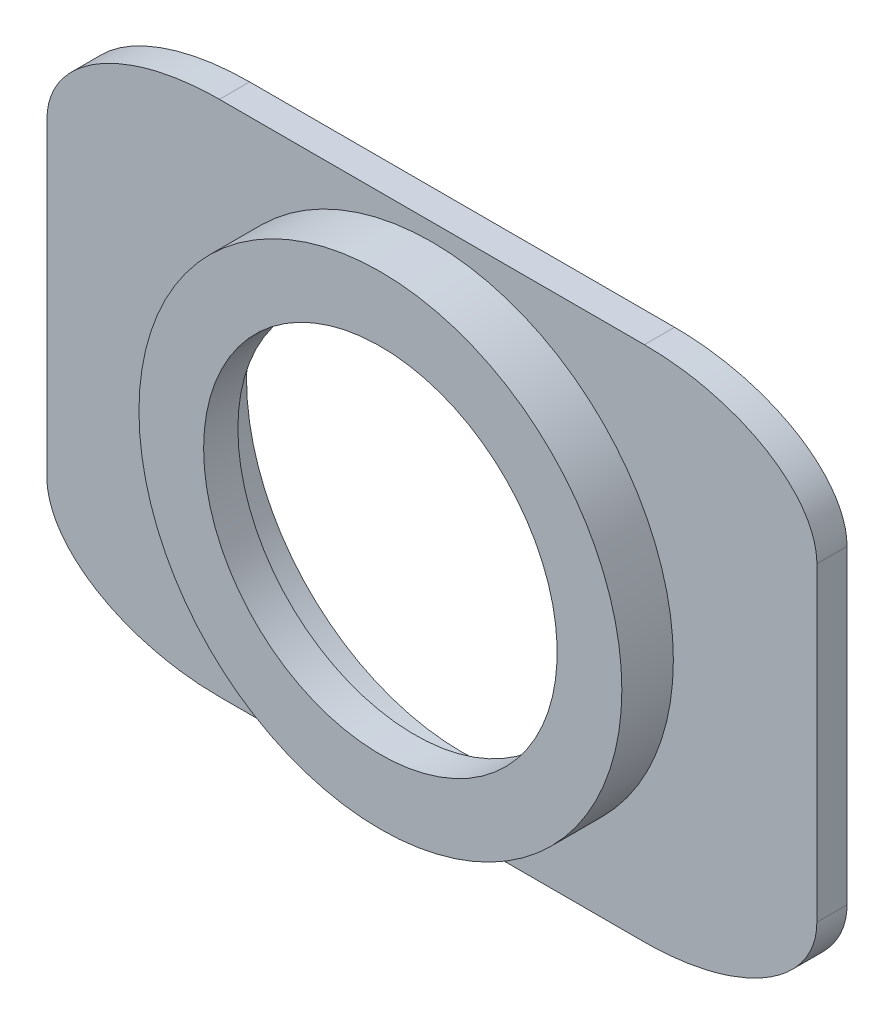
from build123d import *

# Parameters (mm, degrees)
BOSS_EXTRUDE1_DEPTH = 60
SKETCH2_R           = 25
CUT_EXTRUDE1_DEPTH  = 5.5
FILLET1_SIZE        = 12
FILLET1_SIZE_2      = 20
FILLET2_SIZE        = 20
FILLET2_SIZE_2      = 12
FILLET3_SIZE        = 20
FILLET3_SIZE_2      = 12
SKETCH4_R           = 20.5
CUT_EXTRUDE2_DEPTH  = 8.5
SKETCH6_R           = 28
CUT_EXTRUDE3_DEPTH  = 5.973425633


with BuildPart() as part:
    # Sketch1 → Boss-Extrude1 (new body)
    with BuildSketch(Plane(origin=(0, 0, 0), x_dir=(1, 0, 0), z_dir=(0, 1, 0))):
        Polygon((-44.639505024, 1.864709672), (-31.939505024, 1.864709672), (-31.939505024, -4.108715961), (31.939505024, -4.108715961), (31.939505024, 1.864709672), (44.639505024, 1.864709672), (44.639505024, 5.364709672), (-44.639505024, 5.364709672), align=None)
    extrude(amount=BOSS_EXTRUDE1_DEPTH)

    # Sketch2 → Cut-Extrude1 (cut)
    with BuildSketch(Plane(origin=(0, 0, -5.364709672), x_dir=(-1, 0, 0), z_dir=(0, 0, -1))):
        with Locations((0, 30)):
            Circle(SKETCH2_R)
    extrude(amount=-CUT_EXTRUDE1_DEPTH, mode=Mode.SUBTRACT)

    # Fillet1
    # an asymmetric fillet: 20, 12 mm, written as the material it takes off along each edge
    with BuildSketch(Plane(origin=(-44.639505024, 60, -55.364709672), x_dir=(0, -1, 0), z_dir=(0, 0, 1))) as fillet1_piece_1:
        with BuildLine():
            Bezier((FILLET1_SIZE, 0), (0, 0), (0, FILLET1_SIZE_2), weights=[1, 0.707106781, 1])
            Line((0, FILLET1_SIZE_2), (0, 0))
            Line((0, 0), (FILLET1_SIZE, 0))
        make_face()
    extrude(amount=103.5, mode=Mode.SUBTRACT)
    with BuildSketch(Plane(origin=(44.639505024, 60, 48.135290328), x_dir=(-1, 0, 0), z_dir=(0, 0, -1))) as fillet1_piece_2:
        with BuildLine():
            Bezier((FILLET1_SIZE_2, 0), (0, 0), (0, -FILLET1_SIZE), weights=[1, 0.707106781, 1])
            Line((0, -FILLET1_SIZE), (0, 0))
            Line((0, 0), (FILLET1_SIZE_2, 0))
        make_face()
    extrude(amount=103.5, mode=Mode.SUBTRACT)

    # Fillet2
    # an asymmetric fillet: 20, 12 mm, written as the material it takes off along each edge
    with BuildSketch(Plane(origin=(44.639505024, 0, 48.135290328), x_dir=(-1, 0, 0), z_dir=(0, 0, -1))) as fillet2_piece_1:
        with BuildLine():
            Bezier((FILLET2_SIZE, 0), (0, 0), (0, FILLET2_SIZE_2), weights=[1, 0.707106781, 1])
            Line((0, FILLET2_SIZE_2), (0, 0))
            Line((0, 0), (FILLET2_SIZE, 0))
        make_face()
    extrude(amount=103.5, mode=Mode.SUBTRACT)

    # Fillet3
    # an asymmetric fillet: 20, 12 mm, written as the material it takes off along each edge
    with BuildSketch(Plane(origin=(-44.639505024, 0, -55.364709672), x_dir=(1, 0, 0), z_dir=(0, 0, 1))) as fillet3_piece_1:
        with BuildLine():
            Bezier((FILLET3_SIZE, 0), (0, 0), (0, FILLET3_SIZE_2), weights=[1, 0.707106781, 1])
            Line((0, FILLET3_SIZE_2), (0, 0))
            Line((0, 0), (FILLET3_SIZE, 0))
        make_face()
    extrude(amount=103.5, mode=Mode.SUBTRACT)

    # Sketch4 → Cut-Extrude2 (cut)
    with BuildSketch(Plane(origin=(0, 0, 0.135290328), x_dir=(-1, 0, 0), z_dir=(0, 0, -1))):
        with Locations((0, 30)):
            Circle(SKETCH4_R)
    extrude(amount=-CUT_EXTRUDE2_DEPTH, mode=Mode.SUBTRACT)

    # Sketch6 → Cut-Extrude3 (cut)
    with BuildSketch(Plane.XY.offset(4.108715961)):
        with BuildLine():
            Line((-31.939505024, 59.172090225), (-31.939505024, 0.827909775))
            add(Edge.make_bspline(
                [(-31.939505024, 0.827909775), (-28.419914948, -2e-09), (-24.63950501, 0)],
                knots=[0, 0, 0, 1, 1, 1], degree=2))
            Line((-24.63950501, 0), (24.639505024, 0))
            add(Edge.make_bspline(
                [(24.639505024, 0), (28.419914955, 0), (31.939505024, 0.827909775)],
                knots=[0, 0, 0, 1, 1, 1], degree=2))
            Line((31.939505024, 0.827909775), (31.939505024, 59.172090225))
            add(Edge.make_bspline(
                [(31.939505024, 59.172090225), (28.419914948, 60.000000002), (24.63950501, 60)],
                knots=[0, 0, 0, 1, 1, 1], degree=2))
            Line((24.63950501, 60), (-24.639505024, 60))
            add(Edge.make_bspline(
                [(-24.639505024, 60), (-28.419914955, 60), (-31.939505024, 59.172090225)],
                knots=[0, 0, 0, 1, 1, 1], degree=2))
        make_face()
        with Locations((0, 30)):
            Circle(SKETCH6_R, mode=Mode.SUBTRACT)
    extrude(amount=-CUT_EXTRUDE3_DEPTH, mode=Mode.SUBTRACT)


solid = part.part
